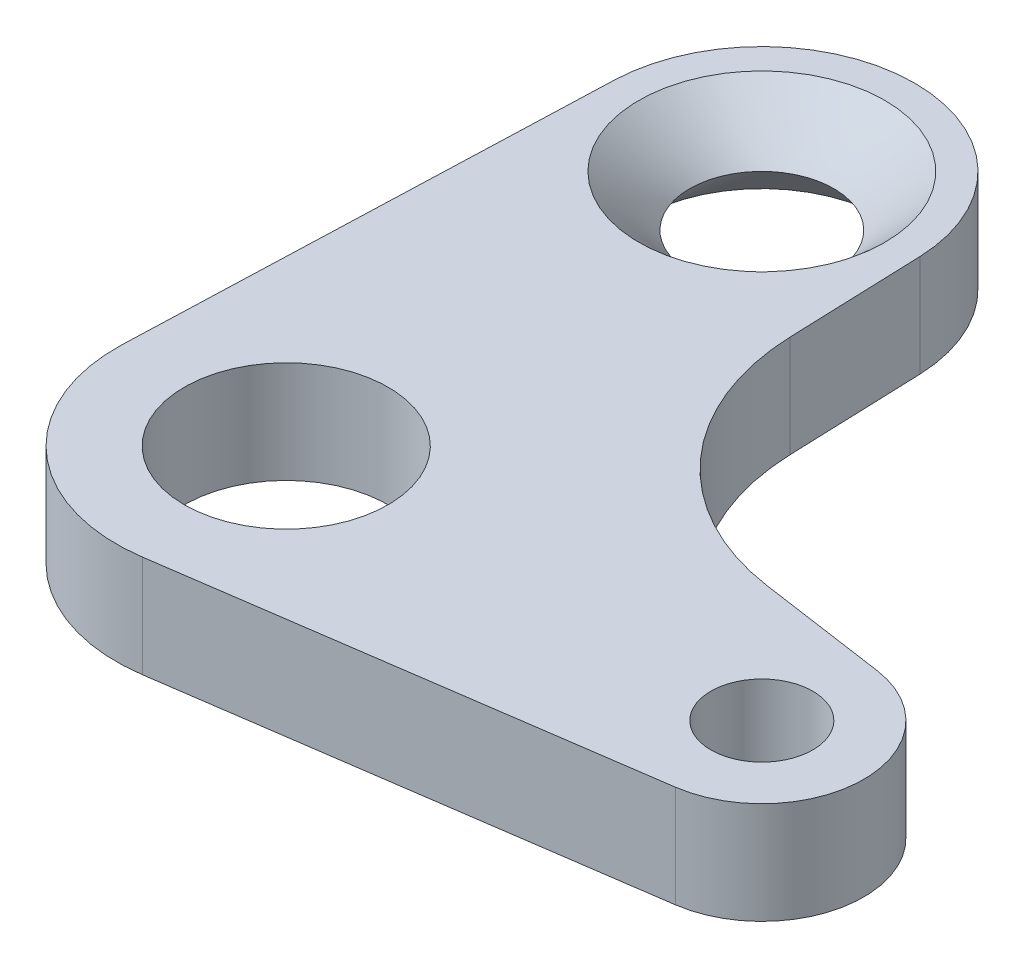
from build123d import *

# Parameters (mm, degrees)
SKETCH1_R           = 3
SKETCH1_R_2         = 1.5
BOSS_EXTRUDE1_DEPTH = 1.5
FILLET1_R           = 7


with BuildPart() as part:
    # Sketch1 → Boss-Extrude1 (new, symmetric)
    with BuildSketch(Plane(origin=(0, 0, 0), x_dir=(1, 0, 0), z_dir=(0, 1, 0))):
        with BuildLine():
            Line((-4.497129186, 14.160714286), (-4.996810207, 0.178571429))
            ThreePointArc((-4.996810207, 0.178571429), (-3.340250682, -3.720581323), (0.714285714, -4.948716593))
            Line((0.714285714, -4.948716593), (14.428571429, -2.969229956))
            ThreePointArc((14.428571429, -2.969229956), (17, 0), (14.428571429, 2.969229956))
            Line((14.428571429, 2.969229956), (4.847659913, 4.352115416))
            Line((4.847659913, 4.352115416), (4.497129186, 14.160714286))
            ThreePointArc((4.497129186, 14.160714286), (0, 18.5), (-4.497129186, 14.160714286))
        make_face()
        with Locations(Location((0, 0, 0), (0, 0, 270))):
            Circle(SKETCH1_R, mode=Mode.SUBTRACT)
        with Locations(Location((14, 0, 0), (0, 0, 270))):
            Circle(SKETCH1_R_2, mode=Mode.SUBTRACT)
    extrude(amount=BOSS_EXTRUDE1_DEPTH, both=True)

    # Cut-Loft1: read off the stored shape, not the designer's step
    # Cut-Loft1: loft between two sections, ruled curve by curve
    cut_loft1_from = [
        Edge.make_bspline([(-3.051453725, 1.5, -15.949985604), (0.848517484, 1.5, -22.052893053), (6.951424933, 1.5, -18.152921845), (3.051453725, 1.5, -12.050014396), (-0.848517484, 1.5, -5.947106947), (-6.951424933, 1.5, -9.847078155), (-3.051453725, 1.5, -15.949985604)], [0, 0, 0, 0, 0.5, 0.5, 0.5, 1, 1, 1, 1], 3, [1, 0.333333333, 0.333333333, 1, 0.333333333, 0.333333333, 1]),
    ]
    cut_loft1_to = [
        Edge.make_bspline([(-1.172439921, 0, -15.767875328), (2.363310734, 0, -18.11275517), (4.708190576, 0, -14.577004515), (1.172439921, 0, -12.232124672), (-2.363310734, 0, -9.88724483), (-4.708190576, 0, -13.422995485), (-1.172439921, 0, -15.767875328)], [0, 0, 0, 0, 0.5, 0.5, 0.5, 1, 1, 1, 1], 3, [1, 0.333333333, 0.333333333, 1, 0.333333333, 0.333333333, 1]),
    ]
    cut_loft1 = Solid(Shell([*[Face.make_surface_from_curves(cut_loft1_from[k], cut_loft1_to[k]) for k in range(1)], Face(Wire(cut_loft1_from)), Face(Wire(cut_loft1_to))]))
    add(cut_loft1, mode=Mode.SUBTRACT)

    # Fillet1
    fillet1_edges = [part.edges().sort_by_distance(p)[0] for p in [
        (4.847659913, 0, -4.352115416),
    ]]
    fillet(fillet1_edges, radius=FILLET1_R)

    # Mirror1: Cut-Loft1 across plane
    add(cut_loft1.mirror(Plane.ZX), mode=Mode.SUBTRACT)


solid = part.part
